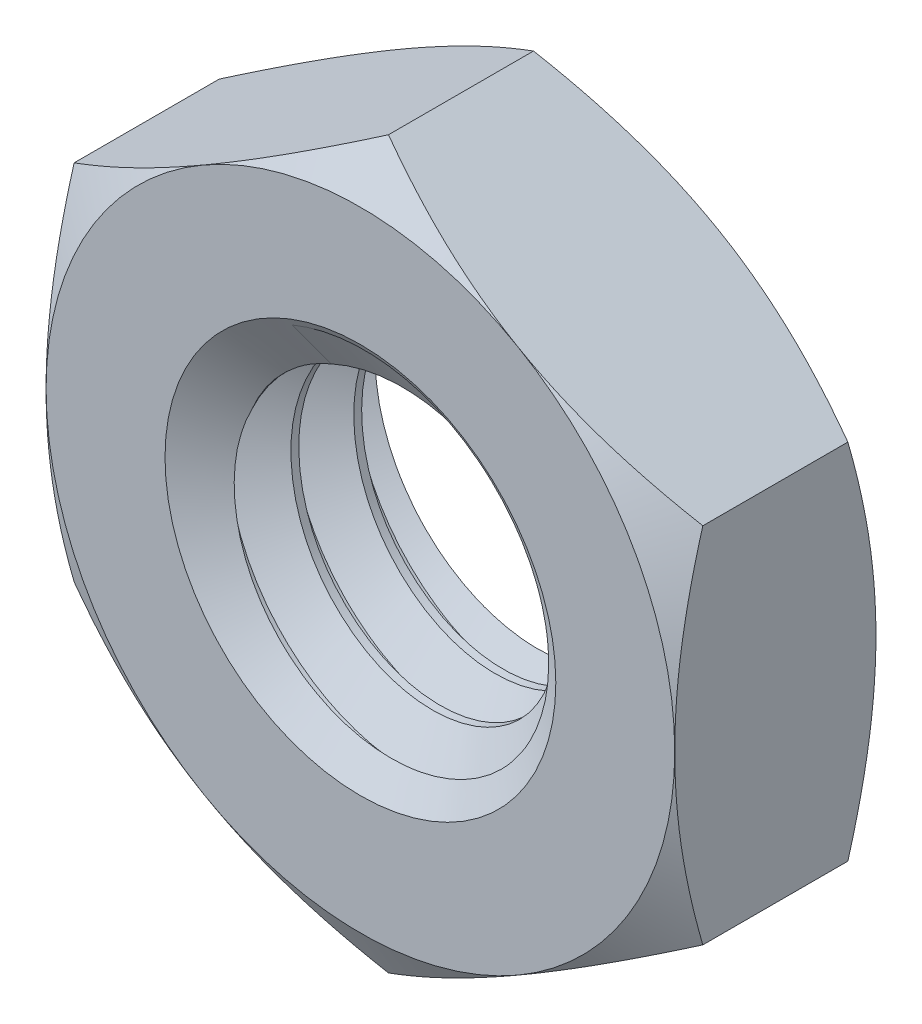
from build123d import *
from OCP.BRepAlgoAPI import BRepAlgoAPI_Cut
from OCP.TopTools import TopTools_ListOfShape

# Parameters (mm, degrees)
SKETCH3_R                    = 2.999999999999999
BOSS_EXTRUDE1_DEPTH          = 1.6
SKETCH4_OUTSIDE_W            = 49.762
SKETCH4_OUTSIDE_H            = 51.31
SKETCH4_OUTSIDE_R            = 5.000000000000004
CUT_EXTRUDE1_DEPTH           = 10
CUT_EXTRUDE1_DRAFT           = -60.000000000000135
SKETCH4_OUTSIDE_R_2          = 3.1082531754730476
CUT_EXTRUDE1_PROFILE_2_DEPTH = 10
CUT_EXTRUDE1_PROFILE_2_DRAFT = -60.000000000000135
MIRROR1_COPY_1_SKETCH_W      = 49.762
MIRROR1_COPY_1_SKETCH_H      = 51.31
MIRROR1_COPY_1_SKETCH_R      = 5.000000000000004
MIRROR1_COPY_1_DEPTH         = 10
MIRROR1_COPY_1_DRAFT         = -60.000000000000135
MIRROR1_COPY_2_SKETCH_R      = 3.1082531754730476
MIRROR1_COPY_2_DEPTH         = 10
MIRROR1_COPY_2_DRAFT         = -60.000000000000135
MIRROR1_COPY_3_SKETCH_R      = 3.1082531754730476
MIRROR1_COPY_3_DEPTH         = 10
MIRROR1_COPY_3_DRAFT         = -60.000000000000135
SWEEP1_PITCH                 = 0.9999999999999981
SWEEP1_HEIGHT                = 4.2
SWEEP1_RADIUS                = 2.999999999999999
SWEEP1_START_ANGLE           = 89.99999999999982
SKETCH8_R                    = 3.1082531754730476
CUT_EXTRUDE2_OTHER_WAY_DEPTH = 9.731369350914052


with BuildPart() as part:
    # Sketch3 → Boss-Extrude1 (new, symmetric)
    with BuildSketch(Plane.XY):
        Polygon((-5.000000000000004, 2.8867513459481313), (-5.000000000000004, -2.8867513459481344), (-2.32e-15, -5.773502691896263), (4.999999999999994, -2.8867513459481398), (4.99999999999999, 2.8867513459481313), (-7.12e-15, 5.773502691896259), align=None)
        Circle(SKETCH3_R, mode=Mode.SUBTRACT)
    extrude(amount=BOSS_EXTRUDE1_DEPTH, both=True)


with BuildPart() as cut_extrude1_tool:
    # Sketch4 outside → Cut-Extrude1 (with draft: the straight prism first)
    with BuildSketch(Plane.XY.offset(1.6)):
        Rectangle(SKETCH4_OUTSIDE_W, SKETCH4_OUTSIDE_H)
        Circle(SKETCH4_OUTSIDE_R, mode=Mode.SUBTRACT)
    extrude(amount=-CUT_EXTRUDE1_DEPTH)
    # Cut-Extrude1: the draft: its side faces are tilted about the plane it starts from
    cut_extrude1_sides = [cut_extrude1_tool.faces().sort_by_distance(p)[0] for p in [
        (0, -25.655, -3.4),
        (24.881, 0, -3.4),
        (0, 25.655, -3.4),
        (-24.881, 0, -3.4),
        (-5, 0, -3.4),
    ]]
    draft(cut_extrude1_sides, Plane.XY.offset(1.6), CUT_EXTRUDE1_DRAFT)


with BuildPart() as part_1:
    add(part.part)

    # Cut-Extrude1: cut by cut_extrude1_tool
    add(cut_extrude1_tool.part, mode=Mode.SUBTRACT)


with BuildPart() as cut_extrude1_profile_2_tool:
    # Sketch4 outside → Cut-Extrude1 profile 2 (with draft: the straight prism first)
    with BuildSketch(Plane.XY.offset(1.6)):
        Circle(SKETCH4_OUTSIDE_R_2)
    extrude(amount=-CUT_EXTRUDE1_PROFILE_2_DEPTH)
    # Cut-Extrude1 profile 2: the draft: its side faces are tilted about the plane it starts from
    cut_extrude1_profile_2_sides = [cut_extrude1_profile_2_tool.faces().sort_by_distance(p)[0] for p in [
        (-3.108253175, 0, -3.4),
    ]]
    draft(cut_extrude1_profile_2_sides, Plane.XY.offset(1.6), CUT_EXTRUDE1_PROFILE_2_DRAFT)


with BuildPart() as part_2:
    add(part_1.part)

    # Cut-Extrude1 profile 2: cut by cut_extrude1_profile_2_tool
    add(cut_extrude1_profile_2_tool.part, mode=Mode.SUBTRACT)


with BuildPart() as mirror1_copy_1_tool:
    # Mirror1 copy 1 sketch → Mirror1 copy 1 (with draft: the straight prism first)
    with BuildSketch(Plane(origin=(0, 0, -1.6), x_dir=(1, 0, 0), z_dir=(0, 0, -1))):
        Rectangle(MIRROR1_COPY_1_SKETCH_W, MIRROR1_COPY_1_SKETCH_H)
        Circle(MIRROR1_COPY_1_SKETCH_R, mode=Mode.SUBTRACT)
    extrude(amount=-MIRROR1_COPY_1_DEPTH)
    # Mirror1 copy 1: the draft: its side faces are tilted about the plane it starts from
    mirror1_copy_1_sides = [mirror1_copy_1_tool.faces().sort_by_distance(p)[0] for p in [
        (0, -25.655, 3.4),
        (24.881, 0, 3.4),
        (0, 25.655, 3.4),
        (-24.881, 0, 3.4),
        (-5, 0, 3.4),
    ]]
    draft(mirror1_copy_1_sides, Plane(origin=(0, 0, -1.6), x_dir=(1, 0, 0), z_dir=(0, 0, -1)), MIRROR1_COPY_1_DRAFT)


with BuildPart() as part_3:
    add(part_2.part)

    # Mirror1 copy 1: cut by mirror1_copy_1_tool
    add(mirror1_copy_1_tool.part, mode=Mode.SUBTRACT)


with BuildPart() as mirror1_copy_2_tool:
    # Mirror1 copy 2 sketch → Mirror1 copy 2 (with draft: the straight prism first)
    with BuildSketch(Plane(origin=(0, 0, -1.6), x_dir=(1, 0, 0), z_dir=(0, 0, -1))):
        Circle(MIRROR1_COPY_2_SKETCH_R)
    extrude(amount=-MIRROR1_COPY_2_DEPTH)
    # Mirror1 copy 2: the draft: its side faces are tilted about the plane it starts from
    mirror1_copy_2_sides = [mirror1_copy_2_tool.faces().sort_by_distance(p)[0] for p in [
        (-3.108253175, 0, 3.4),
    ]]
    draft(mirror1_copy_2_sides, Plane(origin=(0, 0, -1.6), x_dir=(1, 0, 0), z_dir=(0, 0, -1)), MIRROR1_COPY_2_DRAFT)


with BuildPart() as part_4:
    add(part_3.part)

    # Mirror1 copy 2: cut by mirror1_copy_2_tool
    add(mirror1_copy_2_tool.part, mode=Mode.SUBTRACT)


with BuildPart() as mirror1_copy_3_tool:
    # Mirror1 copy 3 sketch → Mirror1 copy 3 (with draft: the straight prism first)
    with BuildSketch(Plane(origin=(0, 0, -1.6), x_dir=(1, 0, 0), z_dir=(0, 0, -1))):
        Circle(MIRROR1_COPY_3_SKETCH_R)
    extrude(amount=-MIRROR1_COPY_3_DEPTH)
    # Mirror1 copy 3: the draft: its side faces are tilted about the plane it starts from
    mirror1_copy_3_sides = [mirror1_copy_3_tool.faces().sort_by_distance(p)[0] for p in [
        (-3.108253175, 0, 3.4),
    ]]
    draft(mirror1_copy_3_sides, Plane(origin=(0, 0, -1.6), x_dir=(1, 0, 0), z_dir=(0, 0, -1)), MIRROR1_COPY_3_DRAFT)


with BuildPart() as part_5:
    add(part_4.part)

    # Mirror1 copy 3: cut by mirror1_copy_3_tool
    add(mirror1_copy_3_tool.part, mode=Mode.SUBTRACT)

    # Sweep1: sweep along a helix
    with BuildLine() as sweep1_path:
        add(Helix(SWEEP1_PITCH, SWEEP1_HEIGHT, SWEEP1_RADIUS, center=(0, 0, 1.6), direction=(0, 0, -1), mode=Mode.PRIVATE).rotate(Axis((0, 0, 1.6), (0, 0, -1)), SWEEP1_START_ANGLE))
    # Sketch7 → Sweep1 (sweep)
    with BuildSketch(Plane(origin=(0, 0, 0), x_dir=(0, 0, -1), z_dir=(1, 0, 0))):
        Polygon((-2.5062500000000085, 3.0541265877365236), (-1.568750000000004, 3.0541265877365236), (-1.9750000000000063, 2.3504809471616634), (-2.1000000000000063, 2.3504809471616634), align=None)
    sweep(path=sweep1_path.line, is_frenet=True)

    # Cut-Extrude2 cone 1 section (through the dimple's axis) → Cut-Extrude2 (revolve, cut)
    with BuildSketch(Plane(origin=(0, 0, 1.6), x_dir=(0, -1, 0), z_dir=(1, 0, 0))):
        Polygon((0, 0), (3.108253175, 0), (0, 1.794550808), align=None)
    revolve(axis=Axis((0, 0, 1.6), (0, 0, -1)), mode=Mode.SUBTRACT)

    # Sketch8 → Cut-Extrude2 other way (cut)
    with BuildSketch(Plane.XY.offset(1.6)):
        Circle(SKETCH8_R)
    extrude(amount=CUT_EXTRUDE2_OTHER_WAY_DEPTH, mode=Mode.SUBTRACT)


with BuildPart() as mirror2_tool:
    # Mirror2: read off the stored shape, not the designer's step
    # Mirror2 outline → Mirror2 (revolve)
    with BuildSketch(Plane.XZ):
        Polygon((3.108253175, -1.6), (2.350470744, -1.162494109), (2.350470744, -2.631563319), (3.108253175, -2.631563319), align=None)
    revolve(axis=Axis((0, 0, 0), (0, 0, 1)))


with BuildPart() as part_6:
    add(part_5.part)

    # Mirror2: cut by mirror2_tool, with a tolerance
    mirror2_stock = TopTools_ListOfShape()
    mirror2_stock.Append(part_6.part.wrapped)
    mirror2_tools = TopTools_ListOfShape()
    mirror2_tools.Append(mirror2_tool.part.wrapped)
    mirror2_cut = BRepAlgoAPI_Cut()
    mirror2_cut.SetArguments(mirror2_stock)
    mirror2_cut.SetTools(mirror2_tools)
    mirror2_cut.SetFuzzyValue(0.00001)
    mirror2_cut.Build()
    add(Compound.cast(mirror2_cut.Shape()).solids(), mode=Mode.REPLACE)


solid = part_6.part
